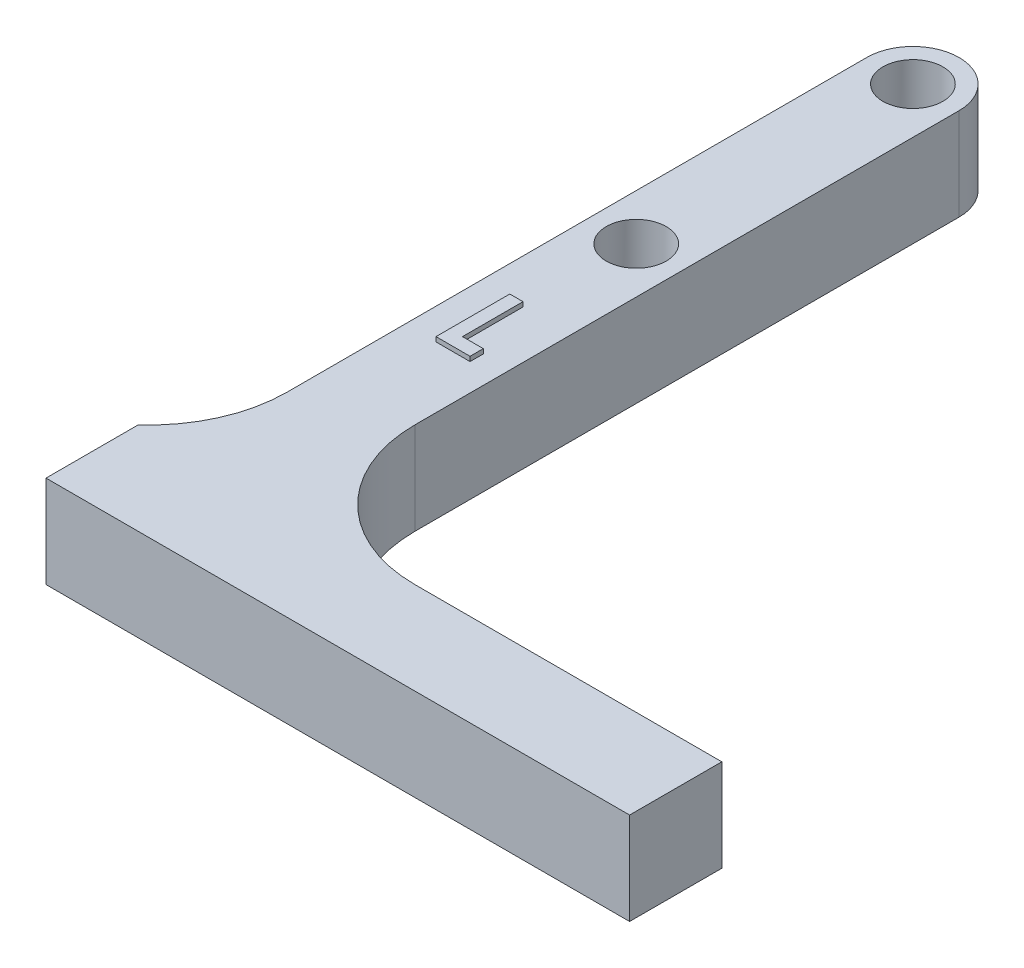
from build123d import *

# Parameters (mm, degrees)
BOSS_EXTRUDE1_DEPTH = 10
SKETCH2_R           = 1.5
CUT_EXTRUDE1_DEPTH  = 107.852975625
BOSS_EXTRUDE2_DEPTH = 0.5
SKETCH5_R           = 3.25
CUT_EXTRUDE2_DEPTH  = 5
FILLET1_R           = 15


with BuildPart() as part:
    # Sketch1 → Boss-Extrude1 (new body)
    with BuildSketch(Plane(origin=(0, 0, 0), x_dir=(1, 0, 0), z_dir=(0, 1, 0))):
        with BuildLine():
            Line((0, 0), (10, 0))
            Line((10, 0), (58.28, 0))
            Line((58.28, 0), (58.28, 10))
            Line((58.28, 10), (10, 10))
            Line((10, 10), (10, 84))
            ThreePointArc((10, 84), (5, 89), (0, 84))
            Line((0, 84), (0, 10))
            Line((0, 10), (-5, 10))
            Line((-5, 10), (-5, 0))
            Line((-5, 0), (0, 0))
        make_face()
    extrude(amount=BOSS_EXTRUDE1_DEPTH)

    # Sketch2 → Cut-Extrude1 (cut, through all)
    with BuildSketch(Plane(origin=(0, 10, 0), x_dir=(1, 0, 0), z_dir=(0, 1, 0))):
        with Locations(Location((5, 84, 0), (0, 0, 270))):
            Circle(SKETCH2_R)
        with Locations(Location((5, 54, 0), (0, 0, 270))):
            Circle(SKETCH2_R)
    extrude(amount=-CUT_EXTRUDE1_DEPTH, mode=Mode.SUBTRACT)

    # Sketch4 → Boss-Extrude2 (add)
    with BuildSketch(Plane(origin=(0, 10, 0), x_dir=(1, 0, 0), z_dir=(0, 1, 0))):
        Polygon((3.358974359, 41.930004151), (4.794871795, 41.930004151), (4.794871795, 35.365901587), (7.051282051, 35.365901587), (7.051282051, 33.930004151), (3.358974359, 33.930004151), align=None)
    extrude(amount=BOSS_EXTRUDE2_DEPTH)

    # Sketch5 → Cut-Extrude2 (cut)
    with BuildSketch(Plane(origin=(0, 10, 0), x_dir=(1, 0, 0), z_dir=(0, 1, 0))):
        with Locations(Location((5, 84, 0), (0, 0, 270))):
            Circle(SKETCH5_R)
        with Locations(Location((5, 54, 0), (0, 0, 270))):
            Circle(SKETCH5_R)
    extrude(amount=-CUT_EXTRUDE2_DEPTH, mode=Mode.SUBTRACT)

    # Fillet1
    # the kernel refuses this fillet: 15 mm, written as the material it adds along each edge
    with BuildSketch(Plane(origin=(0, 0, -10), x_dir=(-1, 0, 0), z_dir=(0, 1, 0))) as fillet1_piece_1:
        with BuildLine():
            CenterArc((15, -11.180339887), FILLET1_R, 131.810314896, 48.189685104)
            Line((0, -11.180339887), (-0.3, -11.180339887))
            Line((-0.3, -11.180339887), (-0.3, 0))
            Line((-0.3, 0), (0, 0.3))
            ThreePointArc((0, 0.3), (2.5, 0.3), (4.8, 0.223606798))
            Line((4.8, 0.223606798), (5, 0))
        make_face()
    extrude(amount=10)
    with BuildSketch(Plane(origin=(10, 0, -10), x_dir=(1, 0, 0), z_dir=(0, 1, 0))) as fillet1_piece_2:
        with BuildLine():
            CenterArc((FILLET1_R, FILLET1_R), FILLET1_R, 180, 90)
            Line((0, FILLET1_R), (-FILLET1_R * 0.02, FILLET1_R))
            Line((-FILLET1_R * 0.02, FILLET1_R), (-FILLET1_R * 0.02, -FILLET1_R * 0.02))
            Line((-FILLET1_R * 0.02, -FILLET1_R * 0.02), (FILLET1_R, -FILLET1_R * 0.02))
            Line((FILLET1_R, -FILLET1_R * 0.02), (FILLET1_R, 0))
        make_face()
    extrude(amount=10)


solid = part.part
